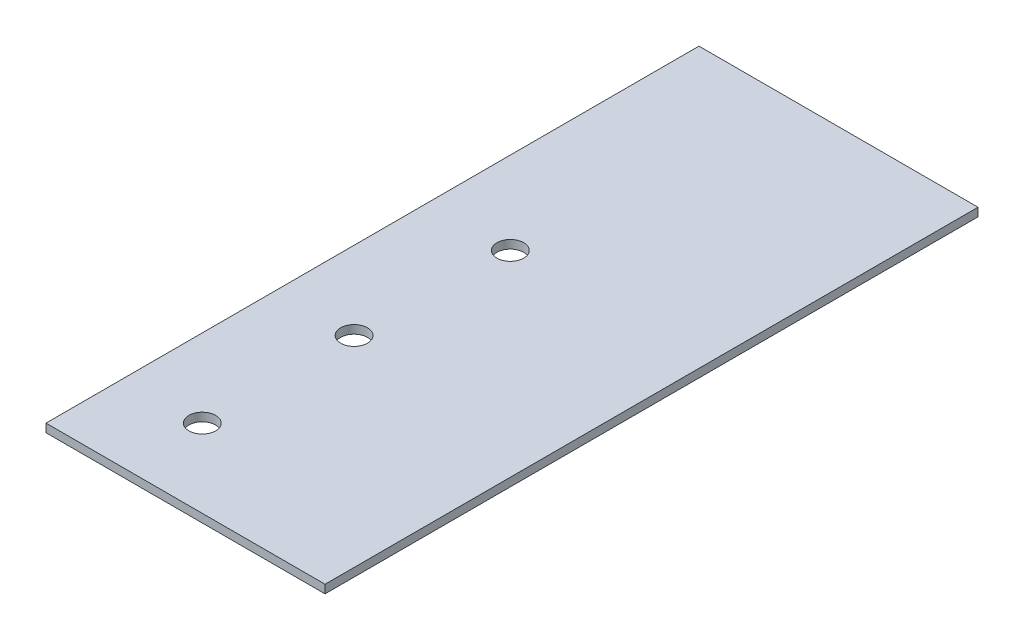
from build123d import *

# Parameters (mm, degrees)
SKETCH1_W           = 63.5
SKETCH1_H           = 148.59
BOSS_EXTRUDE1_DEPTH = 1.905
SKETCH3_R           = 3.048
CUT_EXTRUDE2_DEPTH  = 2.54


with BuildPart() as part:
    # Sketch1 → Boss-Extrude1 (new body)
    with BuildSketch(Plane(origin=(0, 0, 0), x_dir=(1, 0, 0), z_dir=(0, 1, 0))):
        with Locations((31.75, 74.295)):
            Rectangle(SKETCH1_W, SKETCH1_H)
    extrude(amount=BOSS_EXTRUDE1_DEPTH)

    # Sketch3 → Cut-Extrude2 (cut)
    with BuildSketch(Plane.XZ):
        with Locations((18.796, -86.868)):
            Circle(SKETCH3_R)
        with Locations((17.78, -52.324)):
            Circle(SKETCH3_R)
        with Locations((17.78, -17.78)):
            Circle(SKETCH3_R)
    extrude(amount=-CUT_EXTRUDE2_DEPTH, mode=Mode.SUBTRACT)


solid = part.part
